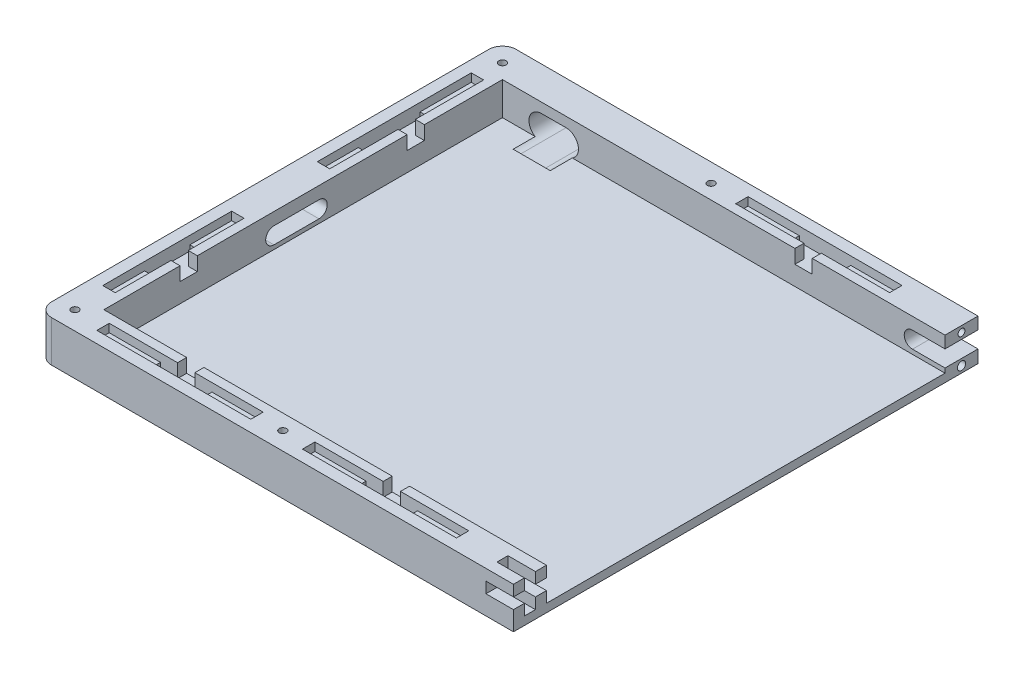
from build123d import *

# Parameters (mm, degrees)
SKETCH1_W           = 161
SKETCH1_H           = 145
BOSS_EXTRUDE1_DEPTH = 3
BOSS_EXTRUDE2_DEPTH = 15
CUT_EXTRUDE1_DEPTH  = 3
CUT_EXTRUDE2_DEPTH  = 2
CUT_EXTRUDE3_DEPTH  = 12
CUT_EXTRUDE5_DEPTH  = 12
CUT_EXTRUDE6_DEPTH  = 20
CUT_EXTRUDE8_DEPTH  = 10
FILLET2_R           = 5
FILLET3_R           = 5
SKETCH11_R          = 1.5
SKETCH11_R_2        = 1.25
CUT_EXTRUDE9_DEPTH  = 10
SKETCH12_R          = 1.325
CUT_EXTRUDE10_DEPTH = 17
SKETCH13_R          = 3
CUT_EXTRUDE11_DEPTH = 5
SKETCH14_R          = 6.25
CUT_EXTRUDE12_DEPTH = 1


with BuildPart() as part:
    # Sketch1 → Boss-Extrude1 (new body)
    with BuildSketch(Plane(origin=(0, 0, 0), x_dir=(1, 0, 0), z_dir=(0, 1, 0))):
        with Locations((-80.5, 0)):
            Rectangle(SKETCH1_W, SKETCH1_H)
    extrude(amount=BOSS_EXTRUDE1_DEPTH)

    # Sketch2 → Boss-Extrude2 (add)
    with BuildSketch(Plane(origin=(0, 0, 0), x_dir=(1, 0, 0), z_dir=(0, 1, 0))):
        Polygon((0, 72.5), (0, 84.5), (-173, 84.5), (-173, -84.5), (0, -84.5), (0, -72.5), (-161, -72.5), (-161, 72.5), align=None)
    extrude(amount=BOSS_EXTRUDE2_DEPTH)

    # Sketch3 → Cut-Extrude1 (cut)
    with BuildSketch(Plane(origin=(0, 15, 0), x_dir=(1, 0, 0), z_dir=(0, 1, 0))):
        Polygon((-161, 44.1), (-161, 37.8), (-164.3, 37.8), (-164.3, 12.95), (-168.8, 12.95), (-168.8, 68.95), (-164.3, 68.95), (-164.3, 44.1), align=None)
        Polygon((-24.95, -75.8), (-49.8, -75.8), (-49.8, -72.5), (-56.1, -72.5), (-56.1, -75.8), (-80.95, -75.8), (-80.95, -80.3), (-24.95, -80.3), align=None)
        Polygon((-161, -38.5), (-161, -44.8), (-164.3, -44.8), (-164.3, -65.1), (-168.8, -65.1), (-168.8, -18.2), (-164.3, -18.2), (-164.3, -38.5), align=None)
        Polygon((-99.75, -80.3), (-99.75, -75.8), (-124.6, -75.8), (-124.6, -72.5), (-130.9, -72.5), (-130.9, -75.8), (-155.75, -75.8), (-155.75, -80.3), align=None)
        Polygon((-48.3, 75.8), (-48.3, 72.5), (-54.6, 72.5), (-54.6, 75.8), (-79.45, 75.8), (-79.45, 80.3), (-23.45, 80.3), (-23.45, 75.8), align=None)
    extrude(amount=-CUT_EXTRUDE1_DEPTH, mode=Mode.SUBTRACT)

    # Sketch4 → Cut-Extrude2 (cut)
    with BuildSketch(Plane(origin=(0, 12, 0), x_dir=(1, 0, 0), z_dir=(0, 1, 0))):
        Polygon((-54.6, 72.5), (-48.3, 72.5), (-48.3, 75.8), (-42.0875, 75.8), (-42.0875, 80.3), (-60.8125, 80.3), (-60.8125, 75.8), (-54.6, 75.8), align=None)
        Polygon((-161, 44.1), (-161, 37.8), (-164.3, 37.8), (-164.3, 27.850226284), (-168.8, 27.850226284), (-168.8, 50.3125), (-164.3, 50.3125), (-164.3, 44.1), align=None)
        Polygon((-168.8, -33.425), (-168.8, -49.875), (-164.3, -49.875), (-164.3, -44.8), (-161, -44.8), (-161, -38.5), (-164.3, -38.5), (-164.3, -33.425), align=None)
        Polygon((-130.9, -72.5), (-130.9, -75.8), (-137.1125, -75.8), (-137.1125, -80.3), (-118.3875, -80.3), (-118.3875, -75.8), (-124.6, -75.8), (-124.6, -72.5), align=None)
        Polygon((-56.1, -75.8), (-62.3125, -75.8), (-62.3125, -80.3), (-43.5875, -80.3), (-43.5875, -75.8), (-49.8, -75.8), (-49.8, -72.5), (-56.1, -72.5), align=None)
    extrude(amount=-CUT_EXTRUDE2_DEPTH, mode=Mode.SUBTRACT)

    # Sketch5 → Cut-Extrude3 (cut)
    with BuildSketch(Plane.ZY.offset(173)):
        with BuildLine():
            Line((-5.75, 10.5), (10.63, 10.5))
            ThreePointArc((10.63, 10.5), (13.63, 7.5), (10.63, 4.5))
            Line((10.63, 4.5), (-5.75, 4.5))
            ThreePointArc((-5.75, 4.5), (-8.75, 7.5), (-5.75, 10.5))
        make_face()
    extrude(amount=-CUT_EXTRUDE3_DEPTH, mode=Mode.SUBTRACT)

    # Sketch7 → Cut-Extrude5 (cut)
    with BuildSketch(Plane(origin=(0, 0, -84.5), x_dir=(-1, 0, 0), z_dir=(0, 0, -1))):
        with BuildLine():
            Line((-4.5375, 10.634328206), (11.8425, 10.634328206))
            ThreePointArc((11.8425, 10.634328206), (14.8425, 7.634328206), (11.8425, 4.634328206))
            Line((11.8425, 4.634328206), (-4.5375, 4.634328206))
            ThreePointArc((-4.5375, 4.634328206), (-7.5375, 7.634328206), (-4.5375, 10.634328206))
        make_face()
    extrude(amount=-CUT_EXTRUDE5_DEPTH, mode=Mode.SUBTRACT)

    # Sketch8 → Cut-Extrude6 (cut)
    with BuildSketch(Plane(origin=(0, 0, -84.5), x_dir=(-1, 0, 0), z_dir=(0, 0, -1))):
        with BuildLine():
            Line((137.86, 11.4), (146.86, 11.4))
            ThreePointArc((146.86, 11.4), (151.36, 6.9), (146.86, 2.4))
            Line((146.86, 2.4), (137.86, 2.4))
            ThreePointArc((137.86, 2.4), (133.36, 6.9), (137.86, 11.4))
        make_face()
    extrude(amount=-CUT_EXTRUDE6_DEPTH, mode=Mode.SUBTRACT)

    # Sketch10 → Cut-Extrude8 (cut)
    with BuildSketch(Plane(origin=(0, 0, 0), x_dir=(0, 0, -1), z_dir=(1, 0, 0))):
        Polygon((-80.5, 15), (-76.5, 15), (-76.5, 11), (-72.5, 11), (-72.5, 7), (-76.5, 7), (-76.5, 3), (-80.5, 3), (-80.5, 7), (-84.5, 7), (-84.5, 11), (-80.5, 11), align=None)
    extrude(amount=-CUT_EXTRUDE8_DEPTH, mode=Mode.SUBTRACT)

    # Fillet2
    fillet2_edges = [part.edges().sort_by_distance(p)[0] for p in [
        (-173, 7.5, 84.5),
    ]]
    fillet(fillet2_edges, radius=FILLET2_R)

    # Fillet3
    fillet3_edges = [part.edges().sort_by_distance(p)[0] for p in [
        (-173, 7.5, -84.5),
    ]]
    fillet(fillet3_edges, radius=FILLET3_R)

    # Sketch11 → Cut-Extrude9 (cut)
    with BuildSketch(Plane(origin=(0, 0, 0), x_dir=(0, 0, -1), z_dir=(1, 0, 0))):
        with Locations((78.5, 2.317164103)):
            Circle(SKETCH11_R)
        with Locations((78.5, 12.817164103)):
            Circle(SKETCH11_R_2)
    extrude(amount=-CUT_EXTRUDE9_DEPTH, mode=Mode.SUBTRACT)

    # Sketch12 → Cut-Extrude10 (cut)
    with BuildSketch(Plane(origin=(0, 0, 0), x_dir=(-1, 0, 0), z_dir=(0, -1, 0))):
        with Locations((166.267766953, -77.767766953)):
            Circle(SKETCH12_R)
        with Locations((90.35, -78.05)):
            Circle(SKETCH12_R)
        with Locations((-80.0525, -78.05)):
            Circle(SKETCH12_R)
        with Locations((-164.807766953, -77.767766953)):
            Circle(SKETCH12_R)
        with Locations((-164.807766953, 77.767766953)):
            Circle(SKETCH12_R)
        with Locations((-80.0525, 78.05)):
            Circle(SKETCH12_R)
        with Locations((90.35, 77.767766953)):
            Circle(SKETCH12_R)
        with Locations((166.267766953, 77.767766953)):
            Circle(SKETCH12_R)
    extrude(amount=-CUT_EXTRUDE10_DEPTH, mode=Mode.SUBTRACT)

    # Sketch13 → Cut-Extrude11 (cut)
    with BuildSketch(Plane.XZ):
        with Locations((-166.267766953, -77.767766953)):
            Circle(SKETCH13_R)
        with Locations((-90.35, -77.767766953)):
            Circle(SKETCH13_R)
        with Locations((-166.267766953, 77.767766953)):
            Circle(SKETCH13_R)
        with Locations((-90.35, 78.05)):
            Circle(SKETCH13_R)
    extrude(amount=-CUT_EXTRUDE11_DEPTH, mode=Mode.SUBTRACT)

    # Sketch14 → Cut-Extrude12 (cut)
    with BuildSketch(Plane(origin=(0, 0, 0), x_dir=(-1, 0, 0), z_dir=(0, -1, 0))):
        with Locations((153, -64.5)):
            Circle(SKETCH14_R)
        with Locations((153, 64.5)):
            Circle(SKETCH14_R)
    extrude(amount=-CUT_EXTRUDE12_DEPTH, mode=Mode.SUBTRACT)


solid = part.part
